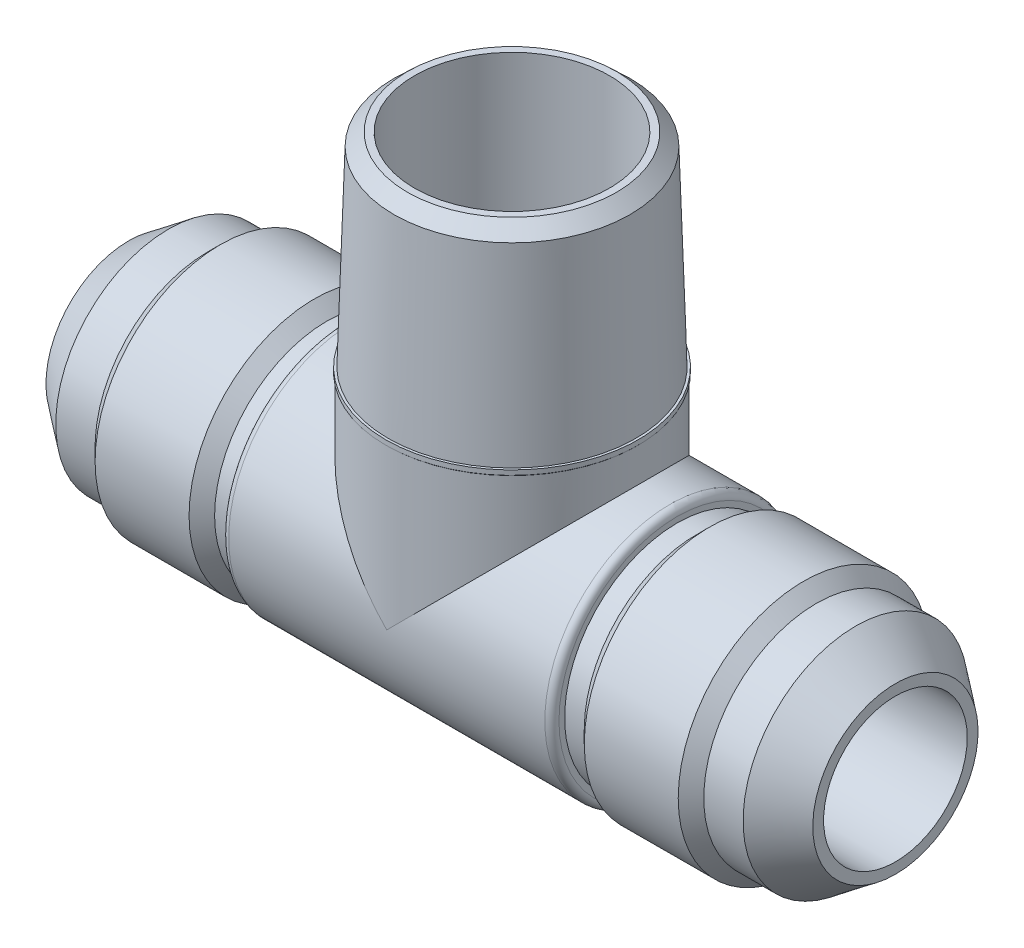
from build123d import *
from build123d.topology import SkipClean

# Parameters (mm, degrees)
SKETCH2_R           = 13.49375
EXTRUDE1_DEPTH      = 23.495
SKETCH15_R          = 13.4874
BOSS_EXTRUDE1_DEPTH = 17.78
SKETCH16_R          = 7.7343
CUT_EXTRUDE1_DEPTH  = 46.47293924
SKETCH20_R          = 13.4874
BOSS_EXTRUDE2_DEPTH = 17.78
SKETCH22_R          = 13.335
BOSS_EXTRUDE3_DEPTH = 21.9075
BOSS_EXTRUDE3_TAPER = 1.75
CHAMFER1_SIZE       = 1.360714286
CHAMFER1_SIZE_2     = 1.404253042
SKETCH25_R          = 13.335
BOSS_EXTRUDE4_DEPTH = 21.9075
BOSS_EXTRUDE4_DRAFT = -15
SKETCH28_R          = 10.499412296
CUT_EXTRUDE6_DEPTH  = 21.9075
FILLET1_R           = 0.762
CIRPATTERN1_COUNT   = 2
CIRPATTERN1_ANGLE   = 180
SKETCH26_R          = 7.7343
CUT_EXTRUDE4_DEPTH  = 93.597306097
SKETCH29_R          = 7.7343
CUT_EXTRUDE7_DEPTH  = 59.850524324


with BuildPart() as part:
    # Sketch2 → Extrude1 (new body)
    with BuildSketch(Plane(origin=(-41.275, 0, 0), x_dir=(0, 0, -1), z_dir=(1, 0, 0))):
        with Locations(Location((0, 0, 0), (0, 0, 180))):
            Circle(SKETCH2_R)
    extrude(amount=EXTRUDE1_DEPTH)

    # Sketch5 → Cut-Revolve1 (revolve, cut)
    with BuildSketch(Plane.XY):
        Polygon((-36.995957679, 12.118934671), (-32.762624346, 12.118934671), (-31.387809017, 13.49375), (-41.275, 13.49375), (-41.275, 8.894445), align=None)
        Polygon((-17.78, 12.118934671), (-19.896666667, 12.118934671), (-21.271481995, 13.49375), (-17.78, 13.49375), align=None)
    revolve(axis=Axis((0, 0, 0), (-1, 0, 0)), mode=Mode.SUBTRACT)

    # Sketch15 → Boss-Extrude1 (add)
    with BuildSketch(Plane(origin=(-17.78, 0, 0), x_dir=(0, 0, -1), z_dir=(1, 0, 0))):
        Circle(SKETCH15_R)
    extrude(amount=BOSS_EXTRUDE1_DEPTH)

    # Sketch16 → Cut-Extrude1 (cut, through all)
    with BuildSketch(Plane(origin=(0, 0, 0), x_dir=(0, 0, -1), z_dir=(1, 0, 0))):
        Circle(SKETCH16_R)
    extrude(amount=-CUT_EXTRUDE1_DEPTH, mode=Mode.SUBTRACT)

    # Fillet1
    fillet1_edges = [part.edges().sort_by_distance(p)[0] for p in [
        (-17.78, 0, 13.4874),
    ]]
    fillet(fillet1_edges, radius=FILLET1_R)


with BuildPart() as body_2:
    # Sketch20 → Boss-Extrude2 (new body)
    with BuildSketch(Plane(origin=(0, 17.78, 0), x_dir=(-1, 0, 0), z_dir=(0, 1, 0))):
        with Locations(Location((0, 0, 0), (0, 0, 90))):
            Circle(SKETCH20_R)
    extrude(amount=-BOSS_EXTRUDE2_DEPTH)


with BuildPart() as body_3:
    # Sketch22 → Boss-Extrude3 (new body)
    with BuildSketch(Plane(origin=(0, 17.78, 0), x_dir=(-1, 0, 0), z_dir=(0, 1, 0))):
        Circle(SKETCH22_R)
    extrude(amount=BOSS_EXTRUDE3_DEPTH, taper=BOSS_EXTRUDE3_TAPER)

    # Chamfer1
    # the kernel refuses this chamfer: 1.404253042, 1.360714286 mm, written as the material it takes off along each edge
    with BuildSketch(Plane(origin=(0, 39.6875, 0), x_dir=(-1, 0, 0), z_dir=(0, 0, 1))) as chamfer1_piece_1:
        Polygon((12.665665338 + CHAMFER1_SIZE * 0.0305385132034, CHAMFER1_SIZE * 0.999533590627), (12.665665338 - CHAMFER1_SIZE_2, 0), (12.665665338, 0), align=None)
    revolve(axis=Axis((0, 39.6875, 0), (0, -1, 0)), mode=Mode.SUBTRACT)


with BuildPart() as boss_extrude4_tool:
    # Sketch25 → Boss-Extrude4 (with draft: the straight prism first)
    with BuildSketch(Plane.XZ.offset(-17.78)):
        Circle(SKETCH25_R)
    extrude(amount=-BOSS_EXTRUDE4_DEPTH)
    # Boss-Extrude4: the draft: its side faces are tilted about the plane it starts from
    boss_extrude4_sides = [boss_extrude4_tool.faces().sort_by_distance(p)[0] for p in [
        (-13.335, 28.73375, 0),
    ]]
    draft(boss_extrude4_sides, Plane.XZ.offset(-17.78), BOSS_EXTRUDE4_DRAFT)


with BuildPart() as body_3_1:
    add(body_3.part)

    # Boss-Extrude4: add boss_extrude4_tool
    add(boss_extrude4_tool.part)

    # Sketch28 → Cut-Extrude6 (cut)
    with BuildSketch(Plane(origin=(0, 39.6875, 0), x_dir=(1, 0, 0), z_dir=(0, 1, 0))):
        with Locations(Location((0, 0, 0), (0, 0, 270))):
            Circle(SKETCH28_R)
    extrude(amount=-CUT_EXTRUDE6_DEPTH, mode=Mode.SUBTRACT)


with BuildPart() as cirpattern1_1:
    # CirPattern1: pattern copy
    add(part.part.rotate(Axis((0, 0, 12.651043997), (0, 0, -1)), 1 * CIRPATTERN1_ANGLE / (CIRPATTERN1_COUNT - 1)))


with BuildPart() as part_1:
    add(part.part)

    # Combine2: union body 3, body 2, CirPattern1_1
    add(body_3_1.part)
    add(body_2.part)
    add(cirpattern1_1.part)

    # Sketch30 → Revolve1 (revolve)
    with SkipClean():  # the faces are left unmerged after this step: merging them gives an invalid solid
        with BuildSketch(Plane.XY, mode=Mode.PRIVATE) as revolve1_sk:
            with BuildLine():
                Line((0, 17.78), (0, 8.89))
                ThreePointArc((0, 8.89), (-7.214370781, 12.4003004), (-13.589, 17.272))
                Line((-13.589, 17.272), (-13.589, 17.78))
                Line((-13.589, 17.78), (0, 17.78))
            make_face()
        revolve(revolve1_sk.sketch.rotate(Axis((0, 17.78, 0), (0, -1, 0)), 270), axis=Axis((0, 17.78, 0), (0, -1, 0)))

    # Sketch26 → Cut-Extrude4 (cut, through all)
    with SkipClean():  # the faces are left unmerged after this step: merging them gives an invalid solid
        with BuildSketch(Plane.ZY.offset(41.275)):
            with Locations(Location((0, 0, 0), (0, 0, 180))):
                Circle(SKETCH26_R)
        extrude(amount=-CUT_EXTRUDE4_DEPTH, mode=Mode.SUBTRACT)

    # Sketch29 → Cut-Extrude7 (cut, through all)
    with SkipClean():  # the faces are left unmerged after this step: merging them gives an invalid solid
        with BuildSketch(Plane(origin=(0, 0, 0), x_dir=(1, 0, 0), z_dir=(0, 1, 0))):
            with Locations(Location((0, 0, 0), (0, 0, 270))):
                Circle(SKETCH29_R)
        extrude(amount=CUT_EXTRUDE7_DEPTH, mode=Mode.SUBTRACT)


solid = part_1.part
